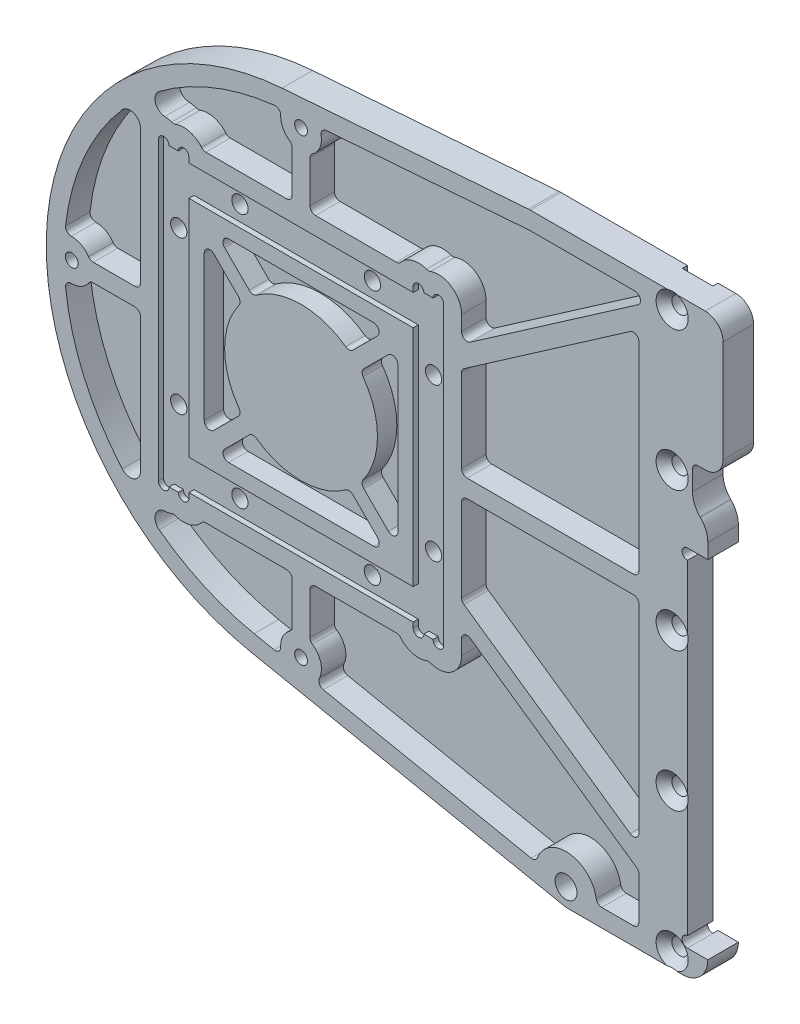
from build123d import *

# Parameters (mm, degrees)
EXTRUDE_1_DEPTH              = 6
EXTRUDE_2_DEPTH              = 6
CUT_EXTRUDE_3_DEPTH          = 1
CUT_EXTRUDE_START            = 6
SKETCH_1_6_W                 = 44
SKETCH_1_6_H                 = 44
CUT_EXTRUDE_5_DEPTH          = 1
CUT_EXTRUDE_6_DEPTH          = 2.75
HOLE_WIZARD_M4_1_D           = 4.3
HOLE_WIZARD_M3_1_D           = 3.2
HOLE_WIZARD_M3_1_CSINK_D     = 6.3
HOLE_WIZARD_M3_1_CSINK_ANGLE = 90
HOLE_WIZARD_M3_2_D           = 3.2
HOLE_WIZARD_M3_2_CSINK_D     = 6.3
HOLE_WIZARD_M3_2_CSINK_ANGLE = 90
M3X0_5_3_D                   = 2.5
FILLET_1_R                   = 5
FILLET_2_R                   = 2
FILLET_3_R                   = 1.05
CUT_EXTRUDE_10_DEPTH         = 4.8
FILLET_5_R                   = 1.1
CUT_EXTRUDE_12_DEPTH         = 3.8
FILLET_6_R                   = 1.1


with BuildPart() as part:
    # Sketch 1 → Extrude 1 (new body)
    with BuildSketch(Plane.XY):
        with BuildLine():
            Line((-3.737823664, 49.860090997), (44.816150628, 53.5))
            Line((44.816150628, 53.5), (76.816150628, 53.5))
            Line((76.816150628, 53.5), (76.816150628, 19.5))
            Line((76.816150628, 19.5), (79.816150628, 16.5))
            Line((79.816150628, 16.5), (79.816150628, 11.5))
            Line((79.816150628, 11.5), (75.816150628, 11.5))
            ThreePointArc((75.816150628, 11.5), (74.766150628, 10.45), (75.816150628, 9.4))
            Line((75.816150628, 9.4), (75.816150628, -54.4))
            ThreePointArc((75.816150628, -54.4), (74.766150628, -55.45), (75.816150628, -56.5))
            Line((75.816150628, -56.5), (79.816150628, -56.5))
            Line((79.816150628, -56.5), (79.816150628, -61.5))
            Line((79.816150628, -61.5), (52, -61.5))
            Line((52, -61.5), (-9.889462435, -49.0122284))
            ThreePointArc((-9.889462435, -49.0122284), (-49.903503057, 3.104896558), (-3.737823664, 49.860090997))
        make_face()
    extrude(amount=EXTRUDE_1_DEPTH)

    # Sketch 1_3 → Extrude 2 (add)
    with BuildSketch(Plane.XY):
        with BuildLine():
            Line((79.316150628, 53.5), (76.816150628, 53.5))
            Line((76.816150628, 53.5), (76.816150628, 26.5))
            Line((76.816150628, 26.5), (79.316150628, 26.5))
            ThreePointArc((79.316150628, 26.5), (81.791024362, 27.525126266), (82.816150628, 30))
            Line((82.816150628, 30), (82.816150628, 50))
            ThreePointArc((82.816150628, 50), (81.791024362, 52.474873734), (79.316150628, 53.5))
        make_face()
    extrude(amount=EXTRUDE_2_DEPTH)

    # Sketch 1_5 → Cut-Extrude 3 (cut)
    with BuildSketch(Plane.XY):
        with BuildLine():
            Line((75.816150628, 53.5), (69.816150628, 53.5))
            Line((69.816150628, 53.5), (69.816150628, -61.5))
            Line((69.816150628, -61.5), (75.816150628, -61.5))
            Line((75.816150628, -61.5), (75.816150628, -56.5))
            ThreePointArc((75.816150628, -56.5), (74.766150628, -55.45), (75.816150628, -54.4))
            Line((75.816150628, -54.4), (75.816150628, 9.4))
            ThreePointArc((75.816150628, 9.4), (74.766150628, 10.45), (75.816150628, 11.5))
            Line((75.816150628, 11.5), (75.816150628, 53.5))
        make_face()
    extrude(amount=CUT_EXTRUDE_3_DEPTH, mode=Mode.SUBTRACT)

    # Sketch 2_5 → Cut-Revolve 3 (revolve, cut)
    with BuildSketch(Plane(origin=(0, 0, 0), x_dir=(0, 0, -1), z_dir=(1, 0, 0)), mode=Mode.PRIVATE) as cut_revolve_3_sk:
        Polygon((-5.5, 0), (0, 0), (0, 12), (-5, 12), (-5, 9), (-5.5, 9), align=None)
    revolve(cut_revolve_3_sk.sketch.rotate(Axis((0, 0, 0), (0, 0, -1)), 90), axis=Axis((0, 0, 0), (0, 0, -1)), mode=Mode.SUBTRACT)

    # Sketch 1_6 → Cut-Extrude 5 (cut)
    with BuildSketch(Plane.XY.offset(CUT_EXTRUDE_START)):
        with BuildLine():
            Line((-22, 28), (22, 28))
            Line((22, 28), (22, 29))
            ThreePointArc((22, 29), (23.05, 30.05), (24.1, 29))
            Line((24.1, 29), (25.9, 29))
            ThreePointArc((25.9, 29), (26.95, 30.05), (28, 29))
            Line((28, 29), (28, -29))
            ThreePointArc((28, -29), (26.95, -30.05), (25.9, -29))
            Line((25.9, -29), (24.1, -29))
            ThreePointArc((24.1, -29), (23.05, -30.05), (22, -29))
            Line((22, -29), (22, -28))
            Line((22, -28), (-22, -28))
            Line((-22, -28), (-22, -29))
            ThreePointArc((-22, -29), (-23.05, -30.05), (-24.1, -29))
            Line((-24.1, -29), (-25.9, -29))
            ThreePointArc((-25.9, -29), (-26.95, -30.05), (-28, -29))
            Line((-28, -29), (-28, 29))
            ThreePointArc((-28, 29), (-26.95, 30.05), (-25.9, 29))
            Line((-25.9, 29), (-24.1, 29))
            ThreePointArc((-24.1, 29), (-23.05, 30.05), (-22, 29))
            Line((-22, 29), (-22, 28))
        make_face()
        Rectangle(SKETCH_1_6_W, SKETCH_1_6_H, mode=Mode.SUBTRACT)
    extrude(amount=-CUT_EXTRUDE_5_DEPTH, mode=Mode.SUBTRACT)

    # Sketch 1_6 2 → Cut-Extrude 6 (cut)
    with BuildSketch(Plane.XY):
        with BuildLine():
            Line((48, -58), (48, -60.692898364))
            Line((48, -60.692898364), (52, -61.5))
            Line((52, -61.5), (56, -61.5))
            Line((56, -61.5), (56, -58))
            ThreePointArc((56, -58), (52, -54), (48, -58))
        make_face()
    extrude(amount=CUT_EXTRUDE_6_DEPTH, mode=Mode.SUBTRACT)

    # Hole Wizard M4 _1 (through all)
    with Locations(Plane(origin=(52, -58, 0), x_dir=(-1, 0, 0), z_dir=(0, 0, -1))):
        with Locations((0, 0)):
            Hole(HOLE_WIZARD_M4_1_D / 2)

    # Hole Wizard M3 _1 (through all)
    with Locations(Plane(origin=(72.816150628, 50.5, 6), x_dir=(1, 0, 0), z_dir=(0, 0, 1))):
        with Locations((0, 0), (0, -27.25), (0, -54.5), (0, -81.75), (0, -109)):
            CounterSinkHole(HOLE_WIZARD_M3_1_D / 2, HOLE_WIZARD_M3_1_CSINK_D / 2, counter_sink_angle=HOLE_WIZARD_M3_1_CSINK_ANGLE)

    # Hole Wizard M3 _2 (through all)
    with Locations(Plane(origin=(-25, 15, 0), x_dir=(-1, 0, 0), z_dir=(0, 0, -1))):
        with Locations((0, 0), (0, -30), (-12, -40), (-38, -40), (-50, -30), (-50, 0), (-38, 10), (-12, 10)):
            CounterSinkHole(HOLE_WIZARD_M3_2_D / 2, HOLE_WIZARD_M3_2_CSINK_D / 2, counter_sink_angle=HOLE_WIZARD_M3_2_CSINK_ANGLE)

    # M3x0.5 _3 (through all)
    with Locations(Plane(origin=(0, 45, 0), x_dir=(-1, 0, 0), z_dir=(0, 0, -1))):
        with Locations((0, 0), (45, -45), (0, -90)):
            Hole(M3X0_5_3_D / 2)

    # Fillet 1
    # the kernel refuses this fillet: 5 mm, written as the material it adds along each edge
    with BuildSketch(Plane(origin=(76.816150628, 19.5, 0), x_dir=(0, 1, 0), z_dir=(0, 0, 1))) as fillet_1_piece_1:
        with BuildLine():
            CenterArc((FILLET_1_R * 0.414213562373, -FILLET_1_R), FILLET_1_R, 90, 45)
            Line((-FILLET_1_R * 0.292893218813, -FILLET_1_R * 0.292893218813), (0, 0))
            Line((0, 0), (FILLET_1_R * 0.414213562373, 0))
        make_face()
    extrude(amount=6)
    # the kernel refuses this fillet: 5 mm, written as the material it takes off along each edge
    with BuildSketch(Plane(origin=(79.816150628, 16.5, -5.17766953), x_dir=(-0.7071067811865501, 0.707106781186545, 0), z_dir=(0, 0, 1))) as fillet_1_2_piece_1:
        with BuildLine():
            CenterArc((FILLET_1_R * 0.414213562373, FILLET_1_R), FILLET_1_R, 225, 45)
            Line((-FILLET_1_R * 0.292893218813, FILLET_1_R * 0.292893218813), (0, 0))
            Line((0, 0), (FILLET_1_R * 0.414213562373, 0))
        make_face()
    extrude(amount=16.355339059, mode=Mode.SUBTRACT)
    with BuildSketch(Plane(origin=(79.816150628, -61.5, -12.5), x_dir=(-1, 0, 0), z_dir=(0, 0, 1))) as fillet_1_2_piece_2:
        with BuildLine():
            CenterArc((FILLET_1_R, -FILLET_1_R), FILLET_1_R, 90, 90)
            Line((0, -FILLET_1_R), (0, 0))
            Line((0, 0), (FILLET_1_R, 0))
        make_face()
    extrude(amount=31, mode=Mode.SUBTRACT)
    with BuildSketch(Plane(origin=(44.816150628, 53.5, -0.467882568), x_dir=(-0.99720181994533, -0.0747564732830667, 0), z_dir=(0, 0, 1))) as fillet_1_2_piece_3:
        with BuildLine():
            CenterArc((FILLET_1_R * 0.0374306054283, FILLET_1_R), FILLET_1_R, 265.712770029, 4.287229971)
            Line((-FILLET_1_R * 0.0373258678548, FILLET_1_R * 0.00279818005467), (0, 0))
            Line((0, 0), (FILLET_1_R * 0.0374306054283, 0))
        make_face()
    extrude(amount=6.935765136, mode=Mode.SUBTRACT)
    with BuildSketch(Plane(origin=(52, -61.5, 1.501484716), x_dir=(-0.9802445680033894, 0.1977892486963046, 0), z_dir=(0, 0, 1))) as fillet_1_2_piece_4:
        with BuildLine():
            CenterArc((FILLET_1_R * 0.0998812226995, -FILLET_1_R), FILLET_1_R, 90, 11.407710002)
            Line((-FILLET_1_R * 0.0979080259968, -FILLET_1_R * 0.0197554319966), (0, 0))
            Line((0, 0), (FILLET_1_R * 0.0998812226995, 0))
        make_face()
    extrude(amount=5.747030567, mode=Mode.SUBTRACT)

    # Fillet 2
    fillet_2_edges = [part.edges().sort_by_distance(p)[0] for p in [
        (56, -61.5, 1.375),
        (48, -60.692898364, 1.375),
    ]]
    fillet(fillet_2_edges, radius=FILLET_2_R)

    # Fillet 3
    fillet_3_edges = [part.edges().sort_by_distance(p)[0] for p in [
        (76.816150628, 26.5, 3),
    ]]
    fillet(fillet_3_edges, radius=FILLET_3_R)

    # Sketch 15 → Cut-Extrude 10 (cut)
    with BuildSketch(Plane.XY.offset(6)):
        Polygon((31.5, -19.716443121), (66.316150628, -43.862399637), (66.316150628, -1.75), (31.5, -1.75), align=None)
        with BuildLine():
            Line((-1.75, -31.5), (-19.248355619, -31.5))
            ThreePointArc((-19.248355619, -31.5), (-21.822830276, -33.381387277), (-25, -33.110960958))
            ThreePointArc((-25, -33.110960958), (-25.842291505, -33.413103431), (-26.727427696, -33.544552956))
            ThreePointArc((-26.727427696, -33.544552956), (-28.587588162, -34.992787651), (-27.855171559, -37.233579165))
            ThreePointArc((-27.855171559, -37.233579165), (-18.99054959, -42.445365192), (-9.197200064, -45.581372412))
            Line((-9.197200064, -45.581372412), (-3.617362226, -46.707246474))
            ThreePointArc((-3.617362226, -46.707246474), (-3.773005019, -43.671680336), (-1.75, -41.403126358))
            Line((-1.75, -41.403126358), (-1.75, -31.5))
        make_face()
        with BuildLine():
            Line((66.316150628, -48.121743382), (31.5, -23.975786866))
            Line((31.5, -23.975786866), (31.5, -29))
            ThreePointArc((31.5, -29), (29.382077301, -32.845451859), (25, -33.110960958))
            ThreePointArc((25, -33.110960958), (21.822830276, -33.381387277), (19.248355619, -31.5))
            Line((19.248355619, -31.5), (1.75, -31.5))
            Line((1.75, -31.5), (1.75, -41.403126358))
            ThreePointArc((1.75, -41.403126358), (3.961195023, -44.444181693), (2.672327395, -47.976351171))
            Line((2.672327395, -47.976351171), (46.132599084, -56.745565269))
            ThreePointArc((46.132599084, -56.745565269), (52.630711703, -52.033241856), (58, -58))
            Line((58, -58), (66.316150628, -58))
            Line((66.316150628, -58), (66.316150628, -48.121743382))
        make_face()
        with BuildLine():
            Line((-19.248355619, 31.5), (-1.75, 31.5))
            Line((-1.75, 31.5), (-1.75, 41.403126358))
            ThreePointArc((-1.75, 41.403126358), (-3.703836367, 43.489504661), (-3.766296893, 46.347222222))
            ThreePointArc((-3.766296893, 46.347222222), (-16.454298502, 43.491448134), (-27.855171559, 37.233579165))
            ThreePointArc((-27.855171559, 37.233579165), (-28.587588162, 34.992787651), (-26.727427696, 33.544552956))
            ThreePointArc((-26.727427696, 33.544552956), (-25.842291505, 33.413103431), (-25, 33.110960958))
            ThreePointArc((-25, 33.110960958), (-21.822830276, 33.381387277), (-19.248355619, 31.5))
        make_face()
        with BuildLine():
            Line((-31.5, -1.75), (-41.403126358, -1.75))
            ThreePointArc((-41.403126358, -1.75), (-43.489504661, -3.703836367), (-46.347222222, -3.766296893))
            ThreePointArc((-46.347222222, -3.766296893), (-42.859805442, -18.035716717), (-35.095260202, -30.505289891))
            ThreePointArc((-35.095260202, -30.505289891), (-32.80687773, -31.071758208), (-31.498655548, -29.110601555))
            ThreePointArc((-31.498655548, -29.110601555), (-31.499663875, -29.055304863), (-31.5, -29))
            Line((-31.5, -29), (-31.5, -1.75))
        make_face()
        Polygon((31.5, 1.75), (66.316150628, 1.75), (66.316150628, 43.862399637), (31.5, 19.716443121), align=None)
        with BuildLine():
            Line((-31.5, 1.75), (-31.5, 29))
            ThreePointArc((-31.5, 29), (-31.499663875, 29.055304863), (-31.498655548, 29.110601555))
            ThreePointArc((-31.498655548, 29.110601555), (-32.80687773, 31.071758208), (-35.095260202, 30.505289891))
            ThreePointArc((-35.095260202, 30.505289891), (-42.859805442, 18.035716717), (-46.347222222, 3.766296893))
            ThreePointArc((-46.347222222, 3.766296893), (-43.489504661, 3.703836367), (-41.403126358, 1.75))
            Line((-41.403126358, 1.75), (-31.5, 1.75))
        make_face()
        with BuildLine():
            Line((44.891168945, 49.99580273), (3.522865319, 46.894576456))
            ThreePointArc((3.522865319, 46.894576456), (3.806544787, 43.771091221), (1.75, 41.403126358))
            Line((1.75, 41.403126358), (1.75, 31.5))
            Line((1.75, 31.5), (19.248355619, 31.5))
            ThreePointArc((19.248355619, 31.5), (21.822830276, 33.381387277), (25, 33.110960958))
            ThreePointArc((25, 33.110960958), (29.382077301, 32.845451859), (31.5, 29))
            Line((31.5, 29), (31.5, 23.975786866))
            Line((31.5, 23.975786866), (69.024416308, 50))
            Line((69.024416308, 50), (45.003303655, 50))
            ThreePointArc((45.003303655, 50), (44.947197037, 49.998950315), (44.891168945, 49.99580273))
        make_face()
    extrude(amount=-CUT_EXTRUDE_10_DEPTH, mode=Mode.SUBTRACT)

    # Fillet 5
    fillet_5_edges = [part.edges().sort_by_distance(p)[0] for p in [
        (66.316150628, -48.121743382, 3.6),
        (66.316150628, -58, 3.6),
        (58, -58, 3.6),
        (46.132599084, -56.745565269, 3.6),
        (2.672327395, -47.976351171, 3.6),
        (1.75, -41.403126358, 3.6),
        (1.75, -31.5, 3.6),
        (19.248355619, -31.5, 3.6),
        (25, -33.110960958, 3.6),
        (31.5, -23.975786866, 3.6),
        (-25, -33.110960958, 3.6),
        (-19.248355619, -31.5, 3.6),
        (-1.75, -31.5, 3.6),
        (-1.75, -41.403126358, 3.6),
        (-3.617362226, -46.707246474, 3.6),
        (31.5, 1.75, 3.6),
        (31.5, 19.716443121, 3.6),
        (66.316150628, 43.862399637, 3.6),
        (66.316150628, 1.75, 3.6),
        (-3.766296893, 46.347222222, 3.6),
        (-1.75, 41.403126358, 3.6),
        (-1.75, 31.5, 3.6),
        (-19.248355619, 31.5, 3.6),
        (-25, 33.110960958, 3.6),
        (-46.347222222, -3.766296893, 3.6),
        (-41.403126358, -1.75, 3.6),
        (-31.5, -1.75, 3.6),
        (-41.403126358, 1.75, 3.6),
        (-46.347222222, 3.766296893, 3.6),
        (-31.5, 1.75, 3.6),
        (1.75, 41.403126358, 3.6),
        (3.522865319, 46.894576456, 3.6),
        (69.024416308, 50, 3.6),
        (31.5, 23.975786866, 3.6),
        (25, 33.110960958, 3.6),
        (19.248355619, 31.5, 3.6),
        (1.75, 31.5, 3.6),
        (66.316150628, -1.75, 3.6),
        (66.316150628, -43.862399637, 3.6),
        (31.5, -19.716443121, 3.6),
        (31.5, -1.75, 3.6),
    ]]
    fillet(fillet_5_edges, radius=FILLET_5_R)

    # Sketch 17 → Cut-Extrude 12 (cut)
    with BuildSketch(Plane.XY.offset(6)):
        with BuildLine():
            Line((19, -16.878679656), (19, 16.878679656))
            Line((19, 16.878679656), (11.614095631, 9.492775288))
            ThreePointArc((11.614095631, 9.492775288), (15, 0), (11.614095631, -9.492775288))
            Line((11.614095631, -9.492775288), (19, -16.878679656))
        make_face()
        with BuildLine():
            Line((-16.878679656, -19), (16.878679656, -19))
            Line((16.878679656, -19), (9.492775288, -11.614095631))
            ThreePointArc((9.492775288, -11.614095631), (0, -15), (-9.492775288, -11.614095631))
            Line((-9.492775288, -11.614095631), (-16.878679656, -19))
        make_face()
        with BuildLine():
            Line((-19, 16.878679656), (-19, -16.878679656))
            Line((-19, -16.878679656), (-11.614095631, -9.492775288))
            ThreePointArc((-11.614095631, -9.492775288), (-15, 0), (-11.614095631, 9.492775288))
            Line((-11.614095631, 9.492775288), (-19, 16.878679656))
        make_face()
        with BuildLine():
            Line((16.878679656, 19), (-16.878679656, 19))
            Line((-16.878679656, 19), (-9.492775288, 11.614095631))
            ThreePointArc((-9.492775288, 11.614095631), (0, 15), (9.492775288, 11.614095631))
            Line((9.492775288, 11.614095631), (16.878679656, 19))
        make_face()
    extrude(amount=-CUT_EXTRUDE_12_DEPTH, mode=Mode.SUBTRACT)

    # Fillet 6
    fillet_6_edges = [part.edges().sort_by_distance(p)[0] for p in [
        (11.614095631, 9.492775288, 4.1),
        (19, 16.878679656, 4.1),
        (19, -16.878679656, 4.1),
        (11.614095631, -9.492775288, 4.1),
        (-9.492775288, 11.614095631, 4.1),
        (-16.878679656, 19, 4.1),
        (16.878679656, 19, 4.1),
        (9.492775288, 11.614095631, 4.1),
        (9.492775288, -11.614095631, 4.1),
        (16.878679656, -19, 4.1),
        (-16.878679656, -19, 4.1),
        (-9.492775288, -11.614095631, 4.1),
        (-19, 16.878679656, 4.1),
        (-11.614095631, 9.492775288, 4.1),
        (-11.614095631, -9.492775288, 4.1),
        (-19, -16.878679656, 4.1),
    ]]
    fillet(fillet_6_edges, radius=FILLET_6_R)


solid = part.part
